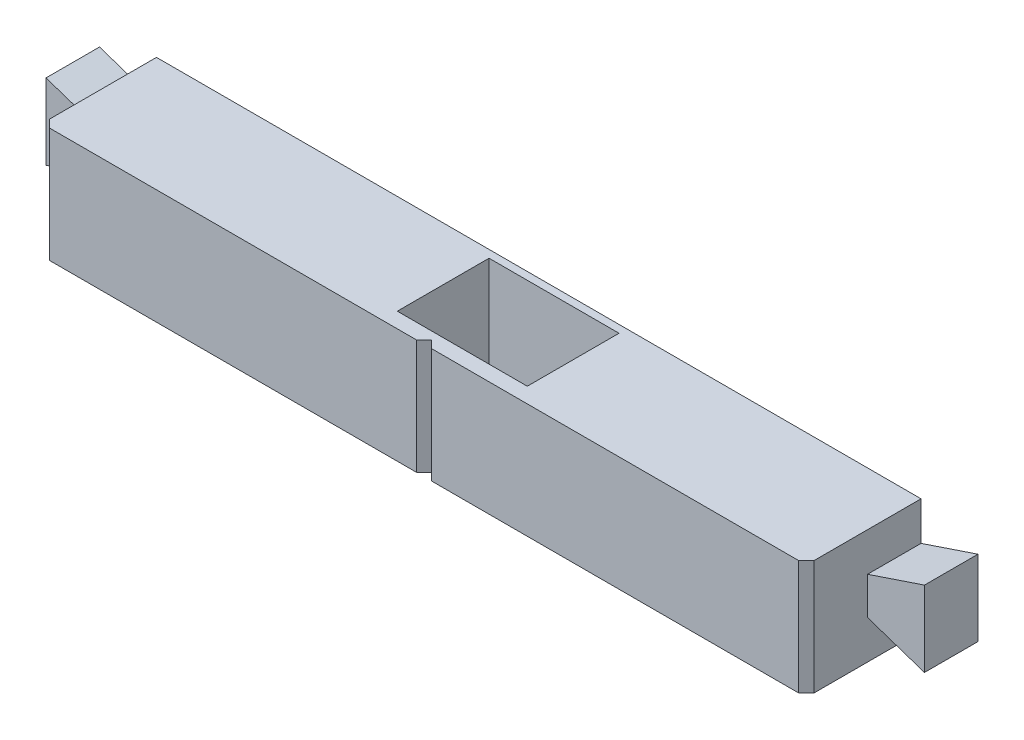
from build123d import *

# Parameters (mm, degrees)
SKETCH1_W               = 100
SKETCH1_H               = 15
BODY_DEPTH              = 15
CLICK_DEPTH             = 7
CLICK_CHAMFER_SIZE      = 1
SKETCH4_W               = 2
SKETCH4_H               = 15
FIELDMARK_DEPTH         = 2
FIELDMARK_CHAMFER_SIZE  = 2
CUT_EXTRUDE1_DEPTH      = 62.241346327
CUT_EXTRUDE1_DEPTH_BACK = 62.241346327
SKETCH5_W               = 11
SKETCH5_H               = 12
SKETCH6_W               = 17
SKETCH6_H               = 12
CUT_EXTRUDE2_DEPTH      = 9


with BuildPart() as part:
    # Sketch1 → Body (new body)
    with BuildSketch(Plane.XY):
        Rectangle(SKETCH1_W, SKETCH1_H)
    extrude(amount=BODY_DEPTH)

    # Sketch2 → Click (add)
    with BuildSketch(Plane.XY):
        Polygon((-50, 0), (-50, 2.45), (-57.45, 4.95), (-57.45, 0), (-57.45, -4.95), (-50, -2.45), align=None)
        Polygon((57.45, 0), (57.45, -4.95), (50, -2.45), (50, 0), (50, 2.45), (57.45, 4.95), align=None)
    extrude(amount=CLICK_DEPTH)

    # Click Chamfer
    click_chamfer_edges = [part.edges().sort_by_distance(p)[0] for p in [
        (-50, 0, 15),
        (50, 0, 15),
    ]]
    chamfer(click_chamfer_edges, length=CLICK_CHAMFER_SIZE)

    # Sketch4 → FieldMark (cut)
    with BuildSketch(Plane.XY.offset(15)):
        Rectangle(SKETCH4_W, SKETCH4_H)
    extrude(amount=-FIELDMARK_DEPTH, mode=Mode.SUBTRACT)

    # FieldMark Chamfer
    # the kernel refuses this chamfer: 2 mm, written as the material it adds along each edge
    with BuildSketch(Plane(origin=(1, -7.5, 13), x_dir=(0.02749587661058638, 0, 0.9996219169112968), z_dir=(0, 1, 0))) as fieldmark_chamfer_piece_1_section:
        Polygon((FIELDMARK_CHAMFER_SIZE * 0.999621916911, -FIELDMARK_CHAMFER_SIZE * 0.0274958766106), (-FIELDMARK_CHAMFER_SIZE * 0.0274958766106, -FIELDMARK_CHAMFER_SIZE * 0.999621916911), (0, 0), align=None)
    fieldmark_chamfer_piece_1 = extrude(amount=15, mode=Mode.PRIVATE)
    fieldmark_chamfer_piece_1 = split(fieldmark_chamfer_piece_1, bisect_by=Plane(origin=(0.339191691, 0, 15), z_dir=(0, 0, -1)), keep=Keep.TOP, mode=Mode.PRIVATE)
    add(fieldmark_chamfer_piece_1)
    with BuildSketch(Plane(origin=(-1, 7.5, 13), x_dir=(0.9996219169112968, 0, -0.027495876610586487), z_dir=(0, -1, 0))) as fieldmark_chamfer_piece_2_section:
        Polygon((FIELDMARK_CHAMFER_SIZE * 0.999621916911, FIELDMARK_CHAMFER_SIZE * 0.0274958766106), (-FIELDMARK_CHAMFER_SIZE * 0.0274958766106, FIELDMARK_CHAMFER_SIZE * 0.999621916911), (0, 0), align=None)
    fieldmark_chamfer_piece_2 = extrude(amount=15, mode=Mode.PRIVATE)
    fieldmark_chamfer_piece_2 = split(fieldmark_chamfer_piece_2, bisect_by=Plane(origin=(-0.339191691, 0, 15), z_dir=(0, 0, -1)), keep=Keep.TOP, mode=Mode.PRIVATE)
    add(fieldmark_chamfer_piece_2)

    # Sketch5 → Cut-Extrude1 (cut, two sides: drawn at the far end of the back side and taken through both)
    with BuildSketch(Plane(origin=(0, 7.5, 0), x_dir=(1, 0, 0), z_dir=(0, 1, 0)).offset(-CUT_EXTRUDE1_DEPTH_BACK)):
        with Locations((0, -7)):
            Rectangle(SKETCH5_W, SKETCH5_H)
    extrude(amount=CUT_EXTRUDE1_DEPTH + CUT_EXTRUDE1_DEPTH_BACK, mode=Mode.SUBTRACT)

    # Sketch6 → Cut-Extrude2 (cut)
    with BuildSketch(Plane(origin=(0, 7.5, 0), x_dir=(1, 0, 0), z_dir=(0, 1, 0))):
        with Locations((3, -7)):
            Rectangle(SKETCH6_W, SKETCH6_H)
    extrude(amount=-CUT_EXTRUDE2_DEPTH, mode=Mode.SUBTRACT)


solid = part.part
